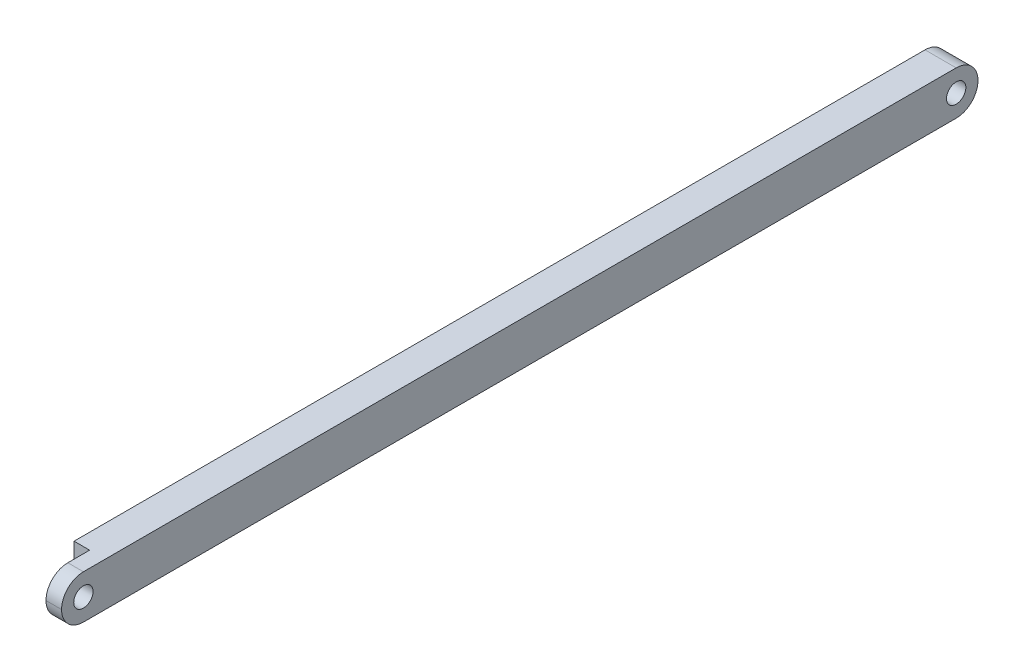
from build123d import *

# Parameters (mm, degrees)
SKETCH_1_W          = 5
SKETCH_1_H          = 7
EXTRUDE_2_DEPTH     = 140
FILLET_1_R          = 3.5
SKETCH_3_R          = 1.55
CUT_EXTRUDE_1_DEPTH = 141.132972565
SKETCH_4_W          = 2.5
SKETCH_4_H          = 7
EXTRUDE_3_DEPTH     = 7
FILLET_2_R          = 3.5
SKETCH_5_R          = 1.55
CUT_EXTRUDE_2_DEPTH = 148.062911708


with BuildPart() as part:
    # 草图1 → 凸台-拉伸2 (new body)
    with BuildSketch(Plane.XY):
        Rectangle(SKETCH_1_W, SKETCH_1_H)
    extrude(amount=EXTRUDE_2_DEPTH)

    # 圆角1
    fillet_1_edges = [part.edges().sort_by_distance(p)[0] for p in [
        (0, -3.5, 0),
        (0, 3.5, 0),
    ]]
    fillet(fillet_1_edges, radius=FILLET_1_R - 0.0001)  # a hair under: the kernel refuses the full size

    # 草图3 → 切除-拉伸1 (cut, through all)
    with BuildSketch(Plane(origin=(2.5, 0, 0), x_dir=(0, 0, -1), z_dir=(1, 0, 0))):
        with Locations(Location((-3.5, 0, 0), (0, 0, 90))):
            Circle(SKETCH_3_R)
    extrude(amount=-CUT_EXTRUDE_1_DEPTH, mode=Mode.SUBTRACT)

    # 草图4 → 凸台-拉伸3 (add)
    with BuildSketch(Plane.XY.offset(140)):
        with Locations((1.25, 0)):
            Rectangle(SKETCH_4_W, SKETCH_4_H)
    extrude(amount=EXTRUDE_3_DEPTH)

    # 圆角2
    fillet_2_edges = [part.edges().sort_by_distance(p)[0] for p in [
        (1.25, -3.5, 147),
        (1.25, 3.5, 147),
    ]]
    fillet(fillet_2_edges, radius=FILLET_2_R - 0.0001)  # a hair under: the kernel refuses the full size

    # 草图5 → 切除-拉伸2 (cut, through all)
    with BuildSketch(Plane.ZY):
        with Locations(Location((143.5, 0, 0), (0, 0, 270))):
            Circle(SKETCH_5_R)
    extrude(amount=-CUT_EXTRUDE_2_DEPTH, mode=Mode.SUBTRACT)


solid = part.part
